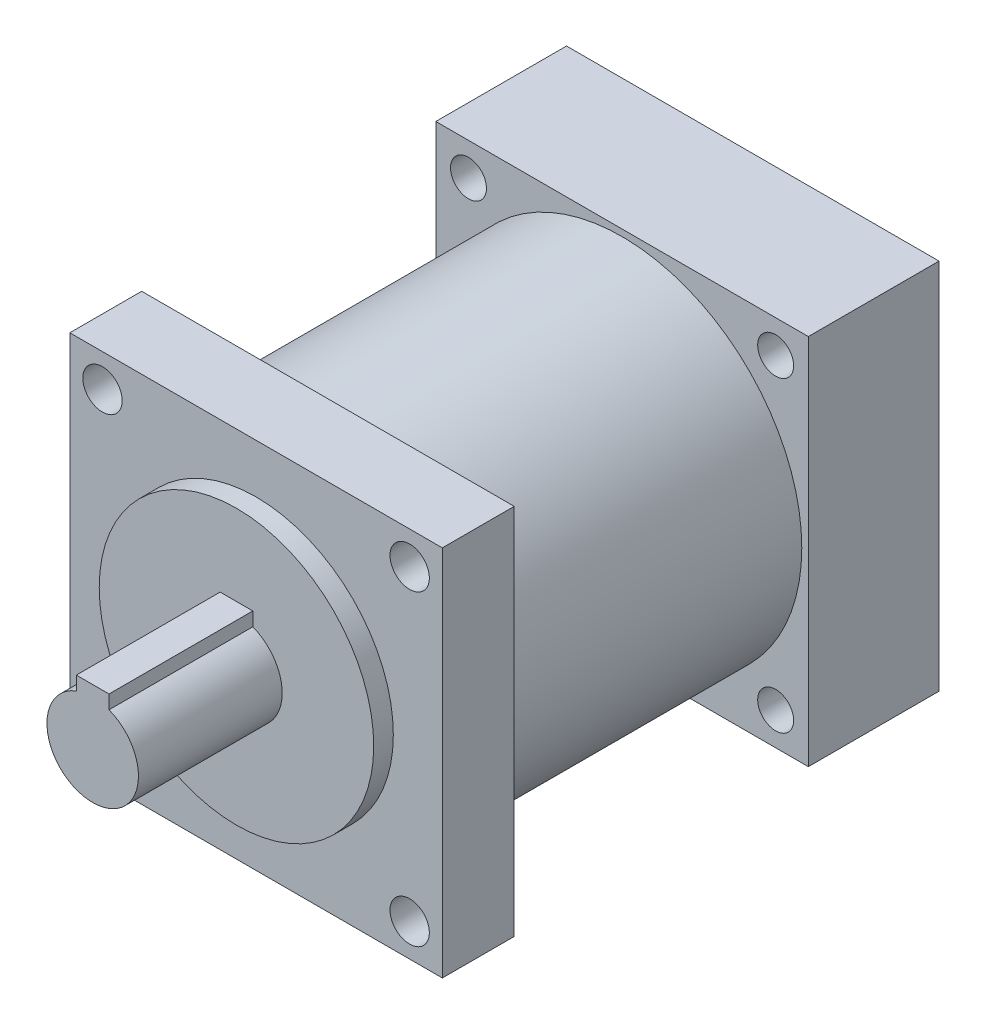
from build123d import *

# Parameters (mm, degrees)
SKETCH_1_W          = 57
SKETCH_1_H          = 57
SKETCH_1_R          = 3.010136902
EXTRUDE_1_DEPTH     = 11
SKETCH_2_R          = 21
EXTRUDE_2_DEPTH     = 3
EXTRUDE_3_DEPTH     = 22
SKETCH_4_R          = 27.5
EXTRUDE_4_DEPTH     = 45
SKETCH_5_W          = 57
SKETCH_5_H          = 57
EXTRUDE_5_DEPTH     = 20
SKETCH_6_R          = 2.75
CUT_EXTRUDE_1_DEPTH = 114.768298144
SKETCH_7_R          = 22.011376544
CUT_EXTRUDE_2_DEPTH = 30


with BuildPart() as part:
    # 草图1 → 凸台-拉伸1 (new body)
    with BuildSketch(Plane.XY):
        with Locations((4.996753247, 11.751623377)):
            Rectangle(SKETCH_1_W, SKETCH_1_H)
        with Locations((-18.503246753, 35.251623377)):
            Circle(SKETCH_1_R, mode=Mode.SUBTRACT)
        with Locations((28.496753247, 35.251623377)):
            Circle(SKETCH_1_R, mode=Mode.SUBTRACT)
        with Locations((-18.503246753, -11.748376623)):
            Circle(SKETCH_1_R, mode=Mode.SUBTRACT)
        with Locations((28.496753247, -11.748376623)):
            Circle(SKETCH_1_R, mode=Mode.SUBTRACT)
    extrude(amount=EXTRUDE_1_DEPTH)

    # 草图2 → 凸台-拉伸2 (add)
    with BuildSketch(Plane.XY.offset(11)):
        with Locations((4.996753247, 11.751623377)):
            Circle(SKETCH_2_R)
    extrude(amount=EXTRUDE_2_DEPTH)

    # 草图3 → 凸台-拉伸3 (add)
    with BuildSketch(Plane.XY.offset(14)):
        with BuildLine():
            Line((7.496753247, 20.389971792), (2.496753247, 20.389971792))
            Line((2.496753247, 20.389971792), (2.496753247, 18.289971792))
            ThreePointArc((2.496753247, 18.289971792), (4.996753247, 4.751623377), (7.496753247, 18.289971792))
            Line((7.496753247, 18.289971792), (7.496753247, 20.389971792))
        make_face()
    extrude(amount=EXTRUDE_3_DEPTH)

    # 草图4 → 凸台-拉伸4 (add)
    with BuildSketch(Plane(origin=(0, 0, 0), x_dir=(-1, 0, 0), z_dir=(0, 0, -1))):
        with Locations((-4.996753247, 11.751623377)):
            Circle(SKETCH_4_R)
    extrude(amount=EXTRUDE_4_DEPTH)

    # 草图5 → 凸台-拉伸5 (add)
    with BuildSketch(Plane(origin=(0, 0, -45), x_dir=(-1, 0, 0), z_dir=(0, 0, -1))):
        with Locations((-4.996753247, 11.751623377)):
            Rectangle(SKETCH_5_W, SKETCH_5_H)
    extrude(amount=EXTRUDE_5_DEPTH)

    # 草图6 → 切除-拉伸1 (cut, through all)
    with BuildSketch(Plane(origin=(0, 0, -65), x_dir=(-1, 0, 0), z_dir=(0, 0, -1))):
        with Locations((-28.496753247, 35.251623377)):
            Circle(SKETCH_6_R)
        with Locations((18.503246753, 35.251623377)):
            Circle(SKETCH_6_R)
        with Locations((18.503246753, -11.748376623)):
            Circle(SKETCH_6_R)
        with Locations((-28.496753247, -11.748376623)):
            Circle(SKETCH_6_R)
    extrude(amount=-CUT_EXTRUDE_1_DEPTH, mode=Mode.SUBTRACT)

    # 草图7 → 切除-拉伸2 (cut)
    with BuildSketch(Plane(origin=(0, 0, -65), x_dir=(-1, 0, 0), z_dir=(0, 0, -1))):
        with Locations((-4.996753247, 11.751623377)):
            Circle(SKETCH_7_R)
    extrude(amount=-CUT_EXTRUDE_2_DEPTH, mode=Mode.SUBTRACT)


solid = part.part
